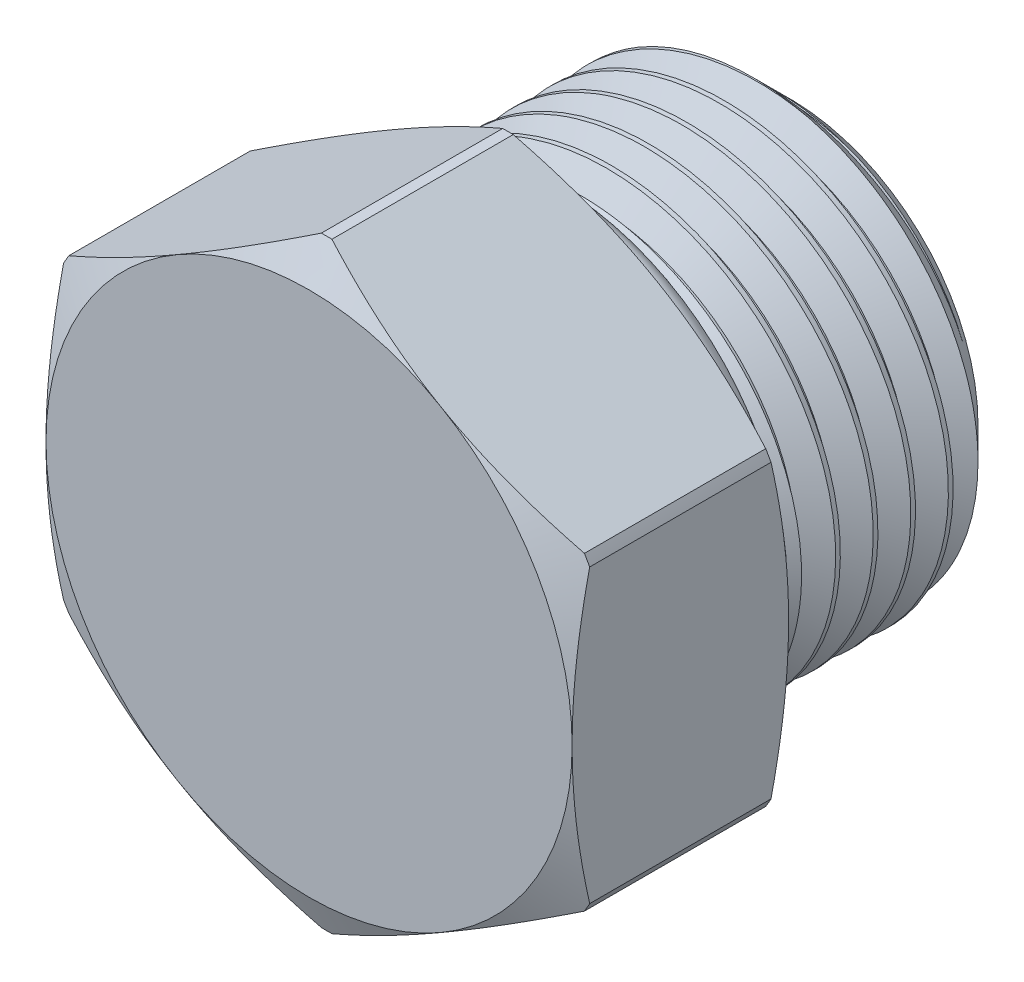
from build123d import *

# Parameters (mm, degrees)
SKETCH1_R        = 9.525
EXTRUDE1_DEPTH   = 11.176
CHAMFER1_SIZE    = 1.5875
CUT_SWEEP1_PITCH = 1.5875
SKETCH4_R        = 8.493888504
EXTRUDE2_DEPTH   = 9.144
EXTRUDE3_DEPTH   = 9.144
HOLE1_D          = 12.7
HOLE1_DEPTH      = 10.16
HOLE1_TIP        = 3.815464931
SKETCH10_R       = 0.79375


with BuildPart() as part:
    # Sketch1 → Extrude1 (new body)
    with BuildSketch(Plane.XY):
        Circle(SKETCH1_R)
    extrude(amount=-EXTRUDE1_DEPTH)

    # Chamfer1
    chamfer1_edges = [part.edges().sort_by_distance(p)[0] for p in [
        (-9.525, 0, -11.176),
    ]]
    chamfer(chamfer1_edges, length=CHAMFER1_SIZE)

    # Sketch11 → Cut-Revolve2 (revolve, cut)
    with BuildSketch(Plane(origin=(0, 0, 0), x_dir=(0, 0, -1), z_dir=(1, 0, 0)), mode=Mode.PRIVATE) as cut_revolve2_sk:
        Polygon((0, 8.334375), (0, 9.525), (2.38125, 9.525), (1.190625, 8.334375), align=None)
    revolve(cut_revolve2_sk.sketch.rotate(Axis((0, 0, 0), (0, 0, -1)), 90), axis=Axis((0, 0, 0), (0, 0, -1)), mode=Mode.SUBTRACT)

    # Cut-Sweep1: the profile of Sketch3 profile screwed along a right-hand helix of 9.04 turns, 8 arcs to a turn; built about Z, then put on its axis
    cut_sweep1_z = Axis((0, 0, 0), (0, 0, 1))
    cut_sweep1_corners = [(0, -9.5253, -1.389235705), (0, -8.493888504, -0.79375), (0, -8.493888504, -0.5953125), (0, -9.5253, 0.000173205)]
    with BuildLine(mode=Mode.PRIVATE) as cut_sweep1_profile:
        Line(cut_sweep1_corners[0], cut_sweep1_corners[1])
        Line(cut_sweep1_corners[1], cut_sweep1_corners[2])
        Line(cut_sweep1_corners[2], cut_sweep1_corners[3])
        Line(cut_sweep1_corners[3], cut_sweep1_corners[0])
    cut_sweep1_cap = Face(cut_sweep1_profile.wire())
    cut_sweep1_turn_angles = [0, 22.5, 45, 67.5, 90, 112.5, 135, 157.5, 180, 202.5, 225, 247.5, 270, 292.5, 315, 337.5, 360]
    cut_sweep1_turn_weights = [1, 0.9238795325112867, 1, 0.9238795325112867, 1, 0.9238795325112867, 1, 0.9238795325112867, 1, 0.9238795325112867, 1, 0.9238795325112867, 1, 0.9238795325112867, 1, 0.9238795325112867, 1]
    cut_sweep1_turn_rails = [Edge.make_bspline([Vector(p[0], p[1], 0).rotate(cut_sweep1_z, cut_sweep1_turn_angles[k]) / cut_sweep1_turn_weights[k] + Vector(0, 0, p[2] + CUT_SWEEP1_PITCH * cut_sweep1_turn_angles[k] / 360) for k in range(17)], [0, 0, 0, 1, 1, 2, 2, 3, 3, 4, 4, 5, 5, 6, 6, 7, 7, 8, 8, 8], 2, cut_sweep1_turn_weights) for p in cut_sweep1_corners]
    cut_sweep1_turn_sides = [Face.make_surface_from_curves(cut_sweep1_turn_rails[p[0]], cut_sweep1_turn_rails[p[1]]) for p in [(0, 1), (1, 2), (2, 3), (3, 0)]]
    cut_sweep1_last_angles = [3240, 3247.2, 3254.4]
    cut_sweep1_last_weights = [1, 0.9921147013144603, 1]
    cut_sweep1_last_rails = [Edge.make_bspline([Vector(p[0], p[1], 0).rotate(cut_sweep1_z, cut_sweep1_last_angles[k]) / cut_sweep1_last_weights[k] + Vector(0, 0, p[2] + CUT_SWEEP1_PITCH * cut_sweep1_last_angles[k] / 360) for k in range(3)], [0, 0, 0, 1, 1, 1], 2, cut_sweep1_last_weights) for p in cut_sweep1_corners]
    cut_sweep1_last_sides = [Face.make_surface_from_curves(cut_sweep1_last_rails[p[0]], cut_sweep1_last_rails[p[1]]) for p in [(0, 1), (1, 2), (2, 3), (3, 0)]]
    cut_sweep1 = Plane(origin=(0, 0, 0), x_dir=(1, 0, 0), z_dir=(0, 0, -1)) * Solid(Shell([*[p.moved(Location((0, 0, CUT_SWEEP1_PITCH * i))) for i in range(9) for p in cut_sweep1_turn_sides], *cut_sweep1_last_sides, cut_sweep1_cap, cut_sweep1_cap.rotate(cut_sweep1_z, 3254.4).moved(Location((0, 0, CUT_SWEEP1_PITCH * 3254.4 / 360)))]))
    add(cut_sweep1, mode=Mode.SUBTRACT)

    # Sketch4 → Extrude2 (add)
    with BuildSketch(Plane.XY.offset(9.144)):
        Circle(SKETCH4_R)
    extrude(amount=-EXTRUDE2_DEPTH)

    # Sketch5 → Extrude3 (add)
    with BuildSketch(Plane.XY.offset(9.144)):
        Polygon((0, 12.831609733), (-11.1125, 6.415804866), (-11.1125, -6.415804866), (0, -12.831609733), (11.1125, -6.415804866), (11.1125, 6.415804866), align=None)
    extrude(amount=-EXTRUDE3_DEPTH)

    # Sketch6 → Cut-Revolve1 (revolve, cut)
    with BuildSketch(Plane(origin=(0, 0, 0), x_dir=(0, 0, -1), z_dir=(1, 0, 0)), mode=Mode.PRIVATE) as cut_revolve1_sk:
        Polygon((-9.144, 12.831609733), (-9.144, 11.1125), (-8.401587039, 12.704609733), (-0.742412961, 12.704609733), (0, 11.1125), (0, 12.831609733), align=None)
    revolve(cut_revolve1_sk.sketch.rotate(Axis((0, 0, 0), (0, 0, 1)), 270), axis=Axis((0, 0, 0), (0, 0, 1)), mode=Mode.SUBTRACT)

    # Hole1
    with Locations(Plane(origin=(0, 0, -11.176), x_dir=(-1, 0, 0), z_dir=(0, 0, -1))):
        with Locations((0, 0)):
            Hole(HOLE1_D / 2, depth=HOLE1_DEPTH)
            with Locations((0, 0, -(HOLE1_DEPTH + HOLE1_TIP / 2))):  # 118° drill point
                Cone(0, HOLE1_D / 2, HOLE1_TIP, mode=Mode.SUBTRACT)


with BuildPart() as body_2:
    # Sketch10 → Revolve1 (revolve)
    with BuildSketch(Plane(origin=(0, 0, 0), x_dir=(0, 0, -1), z_dir=(1, 0, 0)), mode=Mode.PRIVATE) as revolve1_sk:
        with Locations((0.79375, 9.128125)):
            Circle(SKETCH10_R)
    revolve(revolve1_sk.sketch.rotate(Axis((0, 0, 0), (0, 0, 1)), 180.000008775), axis=Axis((0, 0, 0), (0, 0, 1)))


solid = Compound([part.part, body_2.part])
